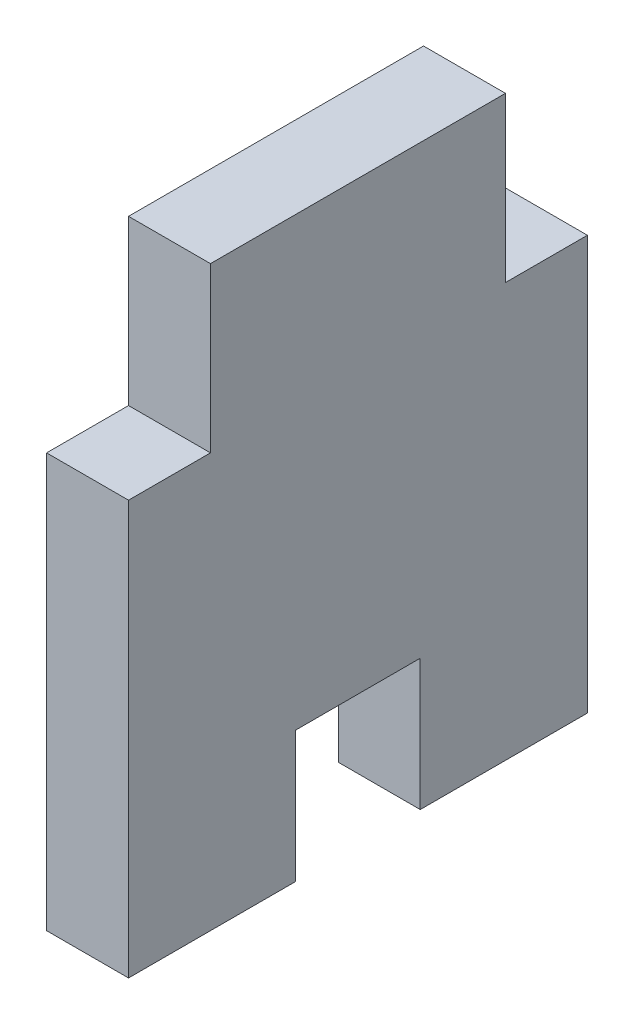
from build123d import *

# Parameters (mm, degrees)
BOSS_EXTRUDE1_DEPTH = 6.35


with BuildPart() as part:
    # Sketch1 → Boss-Extrude1 (new body)
    with BuildSketch(Plane(origin=(0, 0, 0), x_dir=(0, 0, -1), z_dir=(1, 0, 0))):
        Polygon((11.43, 12.7), (-11.43, 12.7), (-11.43, 0), (-17.78, 0), (-17.78, -32.0675), (-4.826, -32.0675), (-4.826, -21.9075), (4.826, -21.9075), (4.826, -32.0675), (17.78, -32.0675), (17.78, 0), (11.43, 0), align=None)
    extrude(amount=BOSS_EXTRUDE1_DEPTH)


solid = part.part
